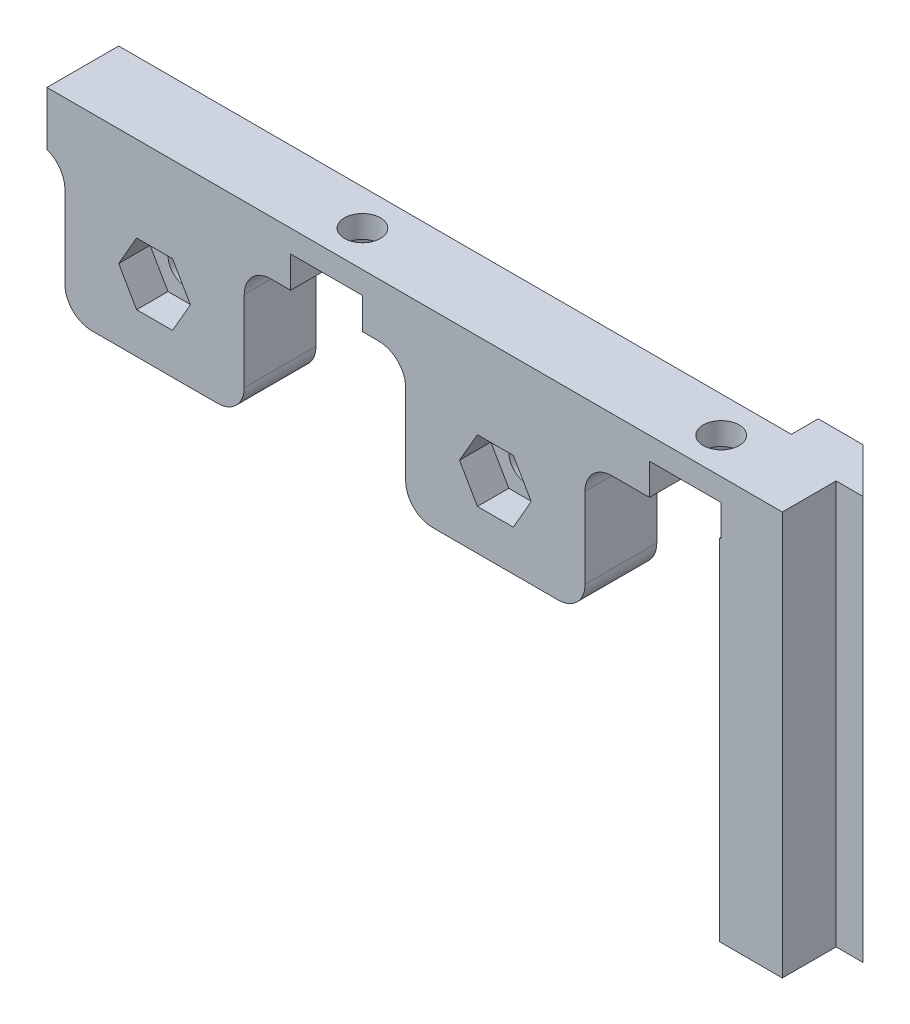
from build123d import *

# Parameters (mm, degrees)
ESQUISSE1_R                  = 2
BOSS_EXTRU_1_DEPTH           = 45
ESQUISSE2_W                  = 75
ESQUISSE2_H                  = 39
ENL_V_MAT_EXTRU_1_DEPTH      = 45
ENL_V_MAT_EXTRU_2_DEPTH      = 3.5
ESQUISSE4_W                  = 20
ESQUISSE4_H                  = 8
BOSS_EXTRU_2_DEPTH           = 15
CONG_1_R                     = 3
ENL_V_MAT_EXTRU_3_DEPTH      = 3.5
ENL_V_MAT_EXTRU_4_DEPTH      = 90.930528743
ENL_V_MAT_EXTRU_4_DEPTH_BACK = 90.930528743
ESQUISSE7_R                  = 2


with BuildPart() as part:
    # Esquisse1 → Boss.-Extru.1 (new body)
    with BuildSketch(Plane(origin=(0, 0, 0), x_dir=(1, 0, 0), z_dir=(0, 1, 0))):
        Polygon((77.5, -2.5), (72.5, 2.5), (67.5, 2.5), (67.5, -0.5), (-7.5, -0.5), (-7.5, -8.5), (74.5, -8.5), (74.5, -2.5), align=None)
        with Locations(Location((63.679491924, -4.5, 0), (0, 0, 90))):
            Circle(ESQUISSE1_R, mode=Mode.SUBTRACT)
        with Locations(Location((23.679491924, -4.5, 0), (0, 0, 90))):
            Circle(ESQUISSE1_R, mode=Mode.SUBTRACT)
    extrude(amount=BOSS_EXTRU_1_DEPTH)

    # Esquisse2 → Enlèv. mat.-Extru.1 (cut)
    with BuildSketch(Plane(origin=(0, 0, 0.5), x_dir=(-1, 0, 0), z_dir=(0, 0, -1))):
        with Locations((-30, 19.5)):
            Rectangle(ESQUISSE2_W, ESQUISSE2_H)
    extrude(amount=-ENL_V_MAT_EXTRU_1_DEPTH, mode=Mode.SUBTRACT)

    # Esquisse3 → Enlèv. mat.-Extru.2 (cut)
    with BuildSketch(Plane.XZ.offset(-39)):
        Polygon((65.679491924, 1.035898385), (61.679491924, 1.035898385), (59.679491924, 4.5), (59.679491924, 8.5), (67.679491924, 8.5), (67.679491924, 4.5), align=None)
        Polygon((25.679491924, 1.035898385), (21.679491924, 1.035898385), (19.679491924, 4.5), (19.679491924, 8.5), (27.679491924, 8.5), (27.679491924, 4.5), align=None)
    extrude(amount=-ENL_V_MAT_EXTRU_2_DEPTH, mode=Mode.SUBTRACT)

    # Esquisse4 → Boss.-Extru.2 (add)
    with BuildSketch(Plane.XZ.offset(-39)):
        with Locations((42.5, 4.5)):
            Rectangle(ESQUISSE4_W, ESQUISSE4_H)
        with Locations((4.5, 4.5)):
            Rectangle(ESQUISSE4_W, ESQUISSE4_H)
    extrude(amount=BOSS_EXTRU_2_DEPTH)

    # Congé1
    # the kernel refuses this fillet: 3 mm, written as the material it adds along each edge
    with BuildSketch(Plane(origin=(52.5, 39, 0.5), x_dir=(1, 0, 0), z_dir=(0, 0, 1)), Plane(origin=(32.5, 39, 8.5), x_dir=(-1, 0, 0), z_dir=(0, 0, -1)), Plane(origin=(14.5, 39, 0.5), x_dir=(1, 0, 0), z_dir=(0, 0, 1))) as cong_1_piece_1:
        with BuildLine():
            CenterArc((CONG_1_R, -CONG_1_R), CONG_1_R, 90, 90)
            Line((0, -CONG_1_R), (0, 0))
            Line((0, 0), (CONG_1_R, 0))
        make_face()
    extrude(amount=8)
    with BuildSketch(Plane(origin=(-5.5, 39, 8.5), x_dir=(-1, 0, 0), z_dir=(0, 0, -1))) as cong_1_piece_2:
        with BuildLine():
            CenterArc((3, -2.828427125), CONG_1_R, 109.471220634, 70.528779366)
            Line((0, -2.828427125), (0, 0))
            Line((0, 0), (2, 0))
        make_face()
    extrude(amount=8)
    # the kernel refuses this fillet: 3 mm, written as the material it takes off along each edge
    with BuildSketch(Plane(origin=(52.5, 24, -7), x_dir=(0, 1, 0), z_dir=(0, 0, 1)), Plane(origin=(14.5, 24, -7), x_dir=(0, 1, 0), z_dir=(0, 0, 1))) as cong_1_2_piece_1:
        with BuildLine():
            CenterArc((CONG_1_R, CONG_1_R), CONG_1_R, 180, 90)
            Line((0, CONG_1_R), (0, 0))
            Line((0, 0), (CONG_1_R, 0))
        make_face()
    extrude(amount=23, mode=Mode.SUBTRACT)
    with BuildSketch(Plane(origin=(32.5, 24, 16), x_dir=(1, 0, 0), z_dir=(0, 0, -1)), Plane(origin=(-5.5, 24, 16), x_dir=(1, 0, 0), z_dir=(0, 0, -1))) as cong_1_2_piece_2:
        with BuildLine():
            CenterArc((CONG_1_R, -CONG_1_R), CONG_1_R, 90, 90)
            Line((0, -CONG_1_R), (0, 0))
            Line((0, 0), (CONG_1_R, 0))
        make_face()
    extrude(amount=23, mode=Mode.SUBTRACT)

    # Esquisse5 → Enlèv. mat.-Extru.3 (cut)
    with BuildSketch(Plane.XY.offset(8.5)):
        Polygon((8.5, 32), (6.5, 28.535898385), (2.5, 28.535898385), (0.5, 32), (2.5, 35.464101615), (6.5, 35.464101615), align=None)
        Polygon((46.5, 32), (44.5, 28.535898385), (40.5, 28.535898385), (38.5, 32), (40.5, 35.464101615), (44.5, 35.464101615), align=None)
    extrude(amount=-ENL_V_MAT_EXTRU_3_DEPTH, mode=Mode.SUBTRACT)

    # Esquisse7 → Enlèv. mat.-Extru.4 (cut, two sides: drawn at the far end of the back side and taken through both)
    with BuildSketch(Plane.XY.offset(5).offset(-ENL_V_MAT_EXTRU_4_DEPTH_BACK)):
        with Locations((4.5, 32)):
            Circle(ESQUISSE7_R)
        with Locations((42.5, 32)):
            Circle(ESQUISSE7_R)
    extrude(amount=ENL_V_MAT_EXTRU_4_DEPTH + ENL_V_MAT_EXTRU_4_DEPTH_BACK, mode=Mode.SUBTRACT)


solid = part.part
